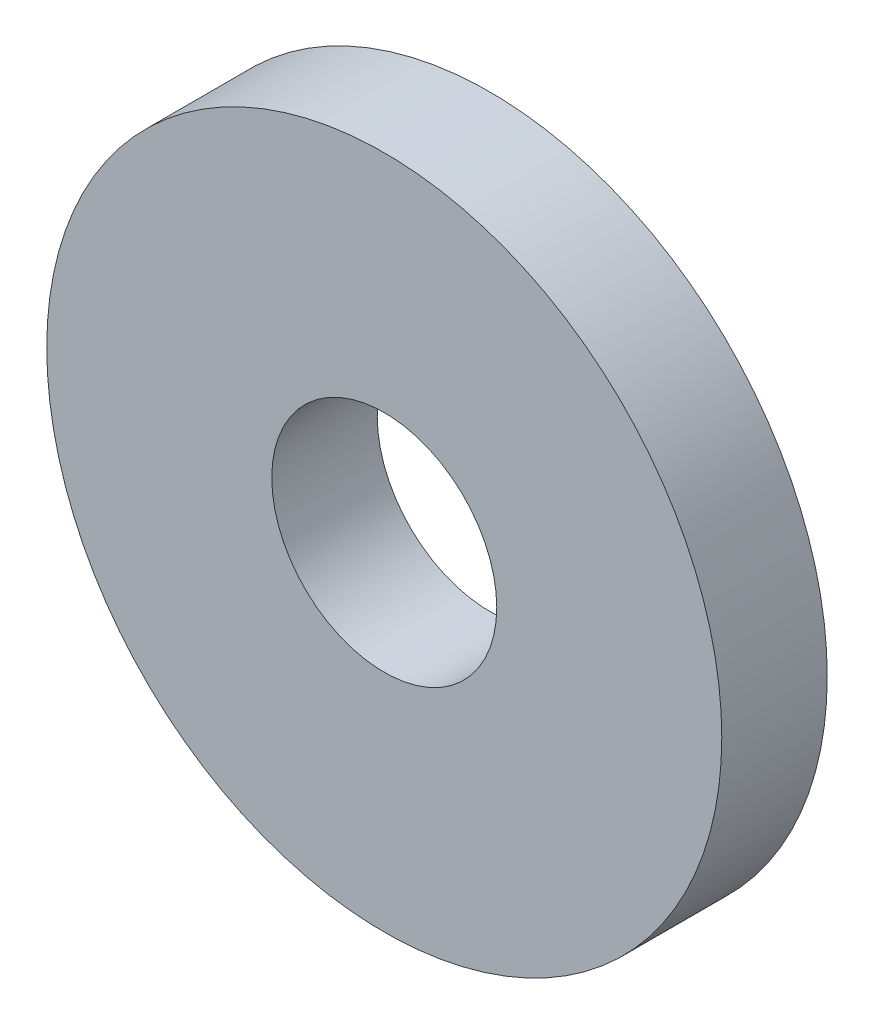
from build123d import *

# Parameters (mm, degrees)
SKETCH1_R           = 12.7
SKETCH1_R_2         = 4.233333333
BOSS_EXTRUDE1_DEPTH = 3.96875
SCALE1_SCALE        = 0.75


with BuildPart() as part:
    # Sketch1 → Boss-Extrude1 (new body)
    with BuildSketch(Plane.XY):
        Circle(SKETCH1_R)
        Circle(SKETCH1_R_2, mode=Mode.SUBTRACT)
    extrude(amount=BOSS_EXTRUDE1_DEPTH)


with BuildPart() as part_1:
    # Scale1: scaled about (0, 0, 1.984375)
    add(part.part.scale(SCALE1_SCALE).moved(Location((0, 0, 0.49609375))))


solid = part_1.part
